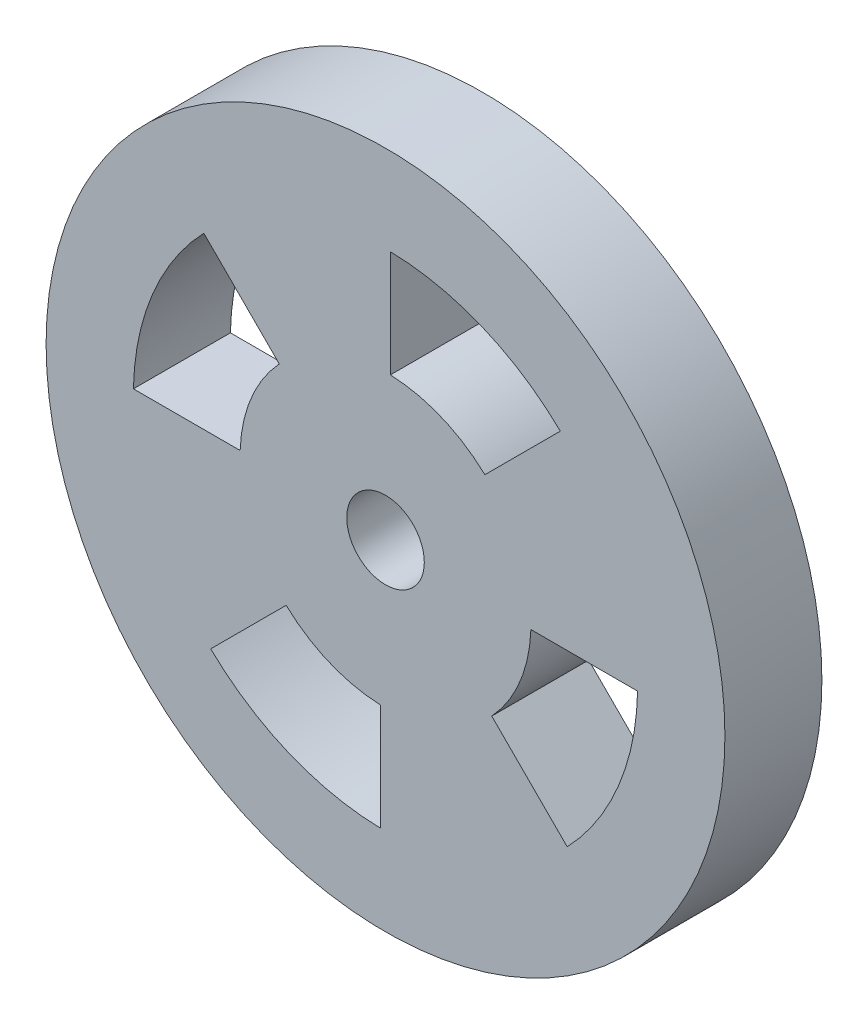
from build123d import *

# Parameters (mm, degrees)
SKETCH2_R           = 3.5
BOSS_EXTRUDE1_DEPTH = 1
SKETCH4_R           = 0.4
CUT_EXTRUDE2_DEPTH  = 6.049752469
CUT_EXTRUDE3_START  = -1
CUT_EXTRUDE3_DEPTH  = 1
CIRPATTERN1_COUNT   = 4


# Read off the part's stored shape, not the designer's step: Cut-Extrude3
with BuildPart() as part:
    # Sketch2 → Boss-Extrude1 (new body)
    with BuildSketch(Plane.XY):
        Circle(SKETCH2_R)
    extrude(amount=BOSS_EXTRUDE1_DEPTH)

    # Sketch4 → Cut-Extrude2 (cut, through all)
    with BuildSketch(Plane.XY.offset(1)):
        Circle(SKETCH4_R)
    extrude(amount=-CUT_EXTRUDE2_DEPTH, mode=Mode.SUBTRACT)

    # Cut-Extrude3 outline → Cut-Extrude3 (cut)
    with BuildSketch(Plane.XY.offset(1).offset(CUT_EXTRUDE3_START)):
        with BuildLine():
            ThreePointArc((-0.05, -1.499166435), (-0.574025148, -1.385819299), (-1.024715413, -1.095426092))
            Line((-1.024715413, -1.095426092), (-1.802782305, -1.873492984))
            ThreePointArc((-1.802782305, -1.873492984), (-0.994976924, -2.402086785), (-0.05, -2.599519186))
            Line((-0.05, -2.599519186), (-0.05, -1.499166435))
        make_face()
    cut_extrude3 = extrude(amount=CUT_EXTRUDE3_DEPTH, mode=Mode.SUBTRACT)

    # CirPattern1: Cut-Extrude3 ×4 about axis
    cirpattern1_axis = Axis((0, 0, 0), (0, 0, 1))
    for i in range(1, CIRPATTERN1_COUNT):
        add(cut_extrude3.rotate(cirpattern1_axis, i * 360 / CIRPATTERN1_COUNT), mode=Mode.SUBTRACT)


solid = part.part
